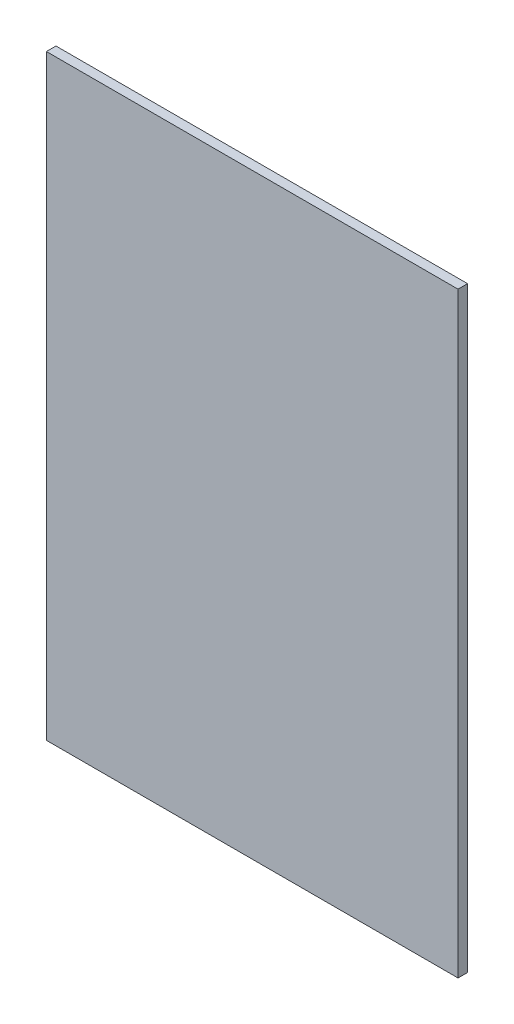
from build123d import *

# Parameters (mm, degrees)
SKETCH1_W           = 69
SKETCH1_H           = 100
BOSS_EXTRUDE1_DEPTH = 1.6


with BuildPart() as part:
    # Sketch1 → Boss-Extrude1 (new body)
    with BuildSketch(Plane.XY):
        with Locations((6.724018476, 10.027713626)):
            Rectangle(SKETCH1_W, SKETCH1_H)
    extrude(amount=BOSS_EXTRUDE1_DEPTH)


solid = part.part
